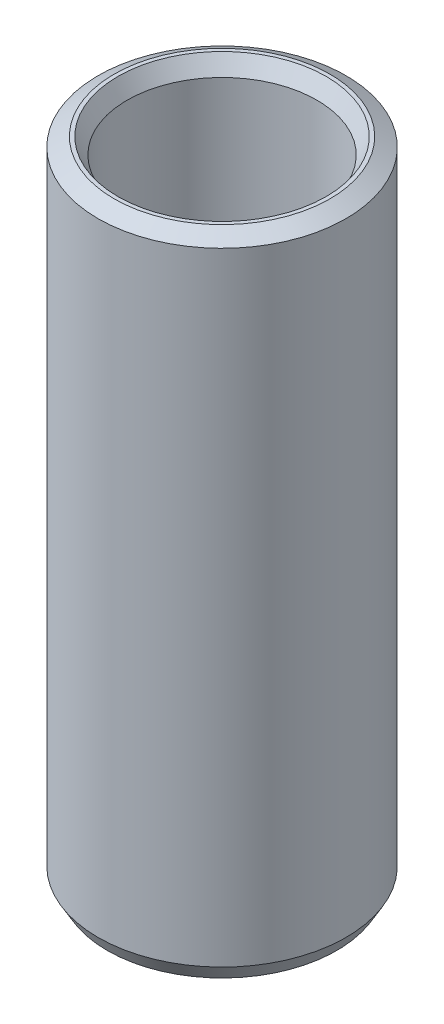
from build123d import *
from OCP.BRepFilletAPI import BRepFilletAPI_MakeChamfer

# Parameters (mm, degrees)
SKETCH1_R           = 17.5
BOSS_EXTRUDE1_DEPTH = 91.453080985
SKETCH2_R           = 13.401236685
CUT_EXTRUDE1_DEPTH  = 95.742630434
CHAMFER1_SIZE       = 1.30141878
CHAMFER1_SIZE2      = 2.254123449


with BuildPart() as part:
    # Sketch1 → Boss-Extrude1 (new body)
    with BuildSketch(Plane(origin=(0, 0, 0), x_dir=(1, 0, 0), z_dir=(0, 1, 0))):
        Circle(SKETCH1_R)
    extrude(amount=BOSS_EXTRUDE1_DEPTH)

    # Sketch2 → Cut-Extrude1 (cut, through all)
    with BuildSketch(Plane(origin=(0, 0, 0), x_dir=(1, 0, 0), z_dir=(0, 1, 0))):
        Circle(SKETCH2_R)
    extrude(amount=CUT_EXTRUDE1_DEPTH, mode=Mode.SUBTRACT)

    # Chamfer1: one chamfer whose edges measure the first distance from different faces: ONE call of the kernel's chamfer builder (chamfer() names one face for all edges)
    chamfer1_edges_1 = [part.edges().sort_by_distance(p)[0] for p in [
        (-13.401236685, 91.453080985, 0),
    ]]
    chamfer1_side_1 = [part.faces().sort_by_distance(p)[0] for p in [
        (-17.005025253, 91.453080985, 0),
    ]]
    chamfer1_edges_2 = [part.edges().sort_by_distance(p)[0] for p in [
        (-13.401236685, 0, 0),
    ]]
    chamfer1_side_2 = [part.faces().sort_by_distance(p)[0] for p in [
        (-13.401236685, 45.726540492, 0),
    ]]
    chamfer1_edges_3 = [part.edges().sort_by_distance(p)[0] for p in [
        (-17.5, 0, 0),
    ]]
    chamfer1_side_3 = [part.faces().sort_by_distance(p)[0] for p in [
        (-17.005025253, 0, 0),
    ]]
    chamfer1_edges_4 = [part.edges().sort_by_distance(p)[0] for p in [
        (-17.5, 91.453080985, 0),
    ]]
    chamfer1_side_4 = [part.faces().sort_by_distance(p)[0] for p in [
        (-17.5, 45.726540492, 0),
    ]]
    chamfer1 = BRepFilletAPI_MakeChamfer(part.part.solid().wrapped)
    for e in chamfer1_edges_1:
        chamfer1.Add(CHAMFER1_SIZE, CHAMFER1_SIZE2, e.wrapped, chamfer1_side_1[0].wrapped)  # the first distance lies on this face
    for e in chamfer1_edges_2:
        chamfer1.Add(CHAMFER1_SIZE, CHAMFER1_SIZE2, e.wrapped, chamfer1_side_2[0].wrapped)  # the first distance lies on this face
    for e in chamfer1_edges_3:
        chamfer1.Add(CHAMFER1_SIZE, CHAMFER1_SIZE2, e.wrapped, chamfer1_side_3[0].wrapped)  # the first distance lies on this face
    for e in chamfer1_edges_4:
        chamfer1.Add(CHAMFER1_SIZE, CHAMFER1_SIZE2, e.wrapped, chamfer1_side_4[0].wrapped)  # the first distance lies on this face
    add(Compound.cast(chamfer1.Shape()), mode=Mode.REPLACE)


solid = part.part
